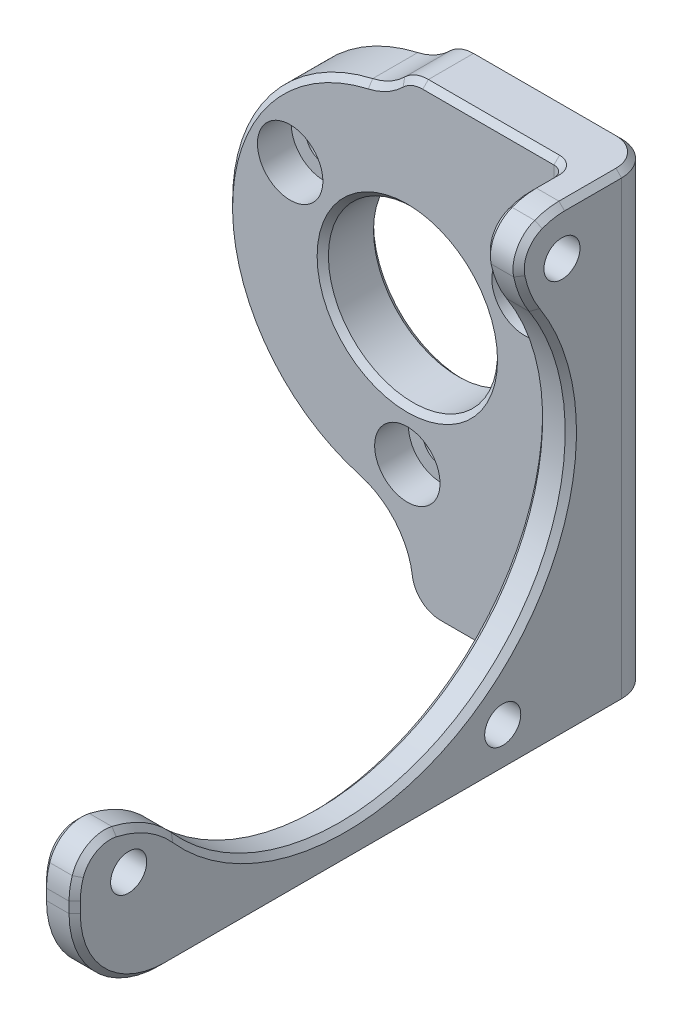
from build123d import *

# Parameters (mm, degrees)
SKETCH_1_R                = 16
EXTRUDE_1_DEPTH           = 5
F_3_0MM_1_D               = 3
F_3_0MM_1_DEPTH           = 3
F_3_0MM_1_TIP             = 0.901290929
HOLE_WIZARD_1_D           = 3.2
HOLE_WIZARD_1_DEPTH       = 5
HOLE_WIZARD_1_CBORE_D     = 5.8
HOLE_WIZARD_1_CBORE_DEPTH = 3
HOLE_WIZARD_1_TIP         = 0.96137699
EXTRUDE_2_DEPTH           = 5
SKETCH_9_W                = 3
SKETCH_9_H                = 46
EXTRUDE_3_DEPTH           = 46.5
SKETCH_12_R               = 1.6
CUT_EXTRUDE_1_DEPTH       = 45
CUT_EXTRUDE_2_DEPTH       = 62.483737687
SKETCH_17_W               = 28.420595315
SKETCH_17_H               = 5
CUT_EXTRUDE_3_DEPTH       = 59.908827861
FILLET_3_R                = 6
FILLET_4_R                = 3
FILLET_5_R                = 1
FILLET_6_R                = 8
CUT_EXTRUDE_4_DEPTH       = 64.326534875
CUT_EXTRUDE_4_DEPTH_BACK  = 64.326534875
SKETCH_18_W               = 60.691939919
SKETCH_18_H               = 58.869698126
SKETCH_19_R               = 7.5
CUT_EXTRUDE_5_DEPTH       = 55.591666189
CHAMFER_1_SIZE            = 0.5


with BuildPart() as part:
    # 草图1 → 凸台-拉伸1 (new body)
    with BuildSketch(Plane.XY):
        Circle(SKETCH_1_R)
    extrude(amount=EXTRUDE_1_DEPTH)

    # Ø3.0mm 暗销孔1
    with Locations(Plane.XY.offset(5)):
        with Locations((0, 12), (10.392304845, -6), (-10.392304845, -6)):
            Hole(F_3_0MM_1_D / 2, depth=F_3_0MM_1_DEPTH)
            with Locations((0, 0, -(F_3_0MM_1_DEPTH + F_3_0MM_1_TIP / 2))):  # 118° drill point
                Cone(0, F_3_0MM_1_D / 2, F_3_0MM_1_TIP, mode=Mode.SUBTRACT)

    # 孔1
    with Locations(Plane(origin=(0, 0, 0), x_dir=(-1, 0, 0), z_dir=(0, 0, -1))):
        with Locations((0, -12), (-10.392304845, 6), (10.392304845, 6)):
            CounterBoreHole(HOLE_WIZARD_1_D / 2, HOLE_WIZARD_1_CBORE_D / 2, HOLE_WIZARD_1_CBORE_DEPTH, depth=HOLE_WIZARD_1_DEPTH)
            with Locations((0, 0, -(HOLE_WIZARD_1_DEPTH + HOLE_WIZARD_1_TIP / 2))):  # 118° drill point
                Cone(0, HOLE_WIZARD_1_D / 2, HOLE_WIZARD_1_TIP, mode=Mode.SUBTRACT)

    # 草图8 → 凸台-拉伸2 (add)
    with BuildSketch(Plane.XY):
        with BuildLine():
            Line((0, 23), (17, 23))
            Line((17, 23), (17, -23))
            Line((17, -23), (0, -23))
            Line((0, -23), (0, -16))
            ThreePointArc((0, -16), (16, 0), (0, 16))
            Line((0, 16), (0, 23))
        make_face()
    extrude(amount=EXTRUDE_2_DEPTH)

    # 草图9 → 凸台-拉伸3 (add)
    with BuildSketch(Plane(origin=(0, 0, 0), x_dir=(-1, 0, 0), z_dir=(0, 0, -1))):
        with Locations((-15.5, 0)):
            Rectangle(SKETCH_9_W, SKETCH_9_H)
    extrude(amount=EXTRUDE_3_DEPTH)

    # 草图12 → 切除-拉伸1 (cut)
    with BuildSketch(Plane(origin=(17, 0, 0), x_dir=(0, 0, -1), z_dir=(1, 0, 0))):
        with Locations(Location((3.285846384, 13.959899742, 0), (0, 0, 90))):
            Circle(SKETCH_12_R)
        with Locations(Location((36.459899742, 19.214153616, 0), (0, 0, 90))):
            Circle(SKETCH_12_R)
        with Locations(Location((41.714153616, -13.959899742, 0), (0, 0, 90))):
            Circle(SKETCH_12_R)
        with Locations(Location((8.540100258, -19.214153616, 0), (0, 0, 90))):
            Circle(SKETCH_12_R)
    extrude(amount=-CUT_EXTRUDE_1_DEPTH, mode=Mode.SUBTRACT)

    # 草图14 → 切除-拉伸2 (cut, through all)
    with BuildSketch(Plane(origin=(17, 0, 0), x_dir=(0, 0, -1), z_dir=(1, 0, 0))):
        with BuildLine():
            Line((7.285846384, 23), (7.285846384, 16.255659243))
            ThreePointArc((7.285846384, 16.255659243), (6.878739032, 13.431405246), (5.690564256, 10.837106162))
            ThreePointArc((5.690564256, 10.837106162), (10.391665009, -15.918172751), (37.430987945, -13.306599828))
            ThreePointArc((37.430987945, -13.306599828), (40.805821772, -10.83485182), (44.896481918, -9.959899742))
            Line((44.896481918, -9.959899742), (46.5, -9.959899742))
            Line((46.5, -9.959899742), (46.5, 23))
            Line((46.5, 23), (7.285846384, 23))
        make_face()
    extrude(amount=-CUT_EXTRUDE_2_DEPTH, mode=Mode.SUBTRACT)

    # 草图17 → 切除-拉伸3 (cut, through all)
    with BuildSketch(Plane.XY.offset(5)):
        with Locations((14.210297658, 20.5)):
            Rectangle(SKETCH_17_W, SKETCH_17_H)
    extrude(amount=-CUT_EXTRUDE_3_DEPTH, mode=Mode.SUBTRACT)

    # 圆角3
    # the kernel refuses this fillet: 6 mm, written as the material it adds along each edge
    with BuildSketch(Plane(origin=(0, -16, 0), x_dir=(-0.9904775075289876, 0.1376746421065417, 0), z_dir=(0, 0, 1))) as fillet_3_piece_1:
        with BuildLine():
            CenterArc((5.2316364, 5.942865045), FILLET_3_R, 187.913310066, 74.173379868)
            Line((-0.711228645, 5.116817193), (-0.830085946, 5.100296235))
            Line((-0.830085946, 5.100296235), (-0.118857301, -0.016520957))
            Line((-0.118857301, -0.016520957), (0.016520957, -0.118857301))
            ThreePointArc((0.016520957, -0.118857301), (2.202794274, 0.03235988), (4.38906759, -0.118857301))
            Line((4.38906759, -0.118857301), (4.405588547, 0))
        make_face()
    extrude(amount=5)
    with BuildSketch(Plane(origin=(0, 16, 0), x_dir=(-0.993666814064824, -0.11236664374387297, 0), z_dir=(0, 0, 1))) as fillet_3_piece_2:
        with BuildLine():
            CenterArc((4.269932462, -5.962000884), FILLET_3_R, 96.45176027, 42.061664666)
            Line((-0.224733287, -1.987333628), (-0.314626602, -1.907840283))
            ThreePointArc((-0.314626602, -1.907840283), (-0.231606661, -0.980182817), (-0.119240018, 0.013483997))
            Line((-0.119240018, 0.013483997), (0.013483997, 0.119240018))
            ThreePointArc((0.013483997, 0.119240018), (1.7978663, 0.018669025), (3.582248603, 0.119240018))
            Line((3.582248603, 0.119240018), (3.5957326, 0))
        make_face()
    extrude(amount=5)
    # the kernel refuses this fillet: 6 mm, written as the material it takes off along each edge
    with BuildSketch(Plane(origin=(27.207517679, -9.959899742, -46.5), x_dir=(0, 0, 1), z_dir=(-1, 0, 0))) as fillet_3_2_piece_1:
        with BuildLine():
            CenterArc((6, -4.083007072), FILLET_3_R, 137.117180669, 42.882819331)
            Line((0, -4.083007072), (-0.12, -4.083007072))
            Line((-0.12, -4.083007072), (-0.12, 0))
            Line((-0.12, 0), (0, 0.12))
            ThreePointArc((0, 0.12), (0.801759041, 0.12), (1.515588444, 0.081660141))
            Line((1.515588444, 0.081660141), (1.603518082, 0))
        make_face()
    extrude(amount=23.415035358, mode=Mode.SUBTRACT)
    with BuildSketch(Plane(origin=(3.426044847, 18, -7.285846384), x_dir=(0, 0, 1), z_dir=(1, 0, 0))) as fillet_3_2_piece_2:
        with BuildLine():
            CenterArc((4.229582061, 6), FILLET_3_R, 225.176083116, 44.823916884)
            Line((0, 1.744340757), (-0.084591641, 1.659227573))
            ThreePointArc((-0.084591641, 1.659227573), (-0.12, 0.872170379), (-0.12, 0))
            Line((-0.12, 0), (0, -0.12))
            Line((0, -0.12), (4.229582061, -0.12))
            Line((4.229582061, -0.12), (4.229582061, 0))
        make_face()
    extrude(amount=24.147910306, mode=Mode.SUBTRACT)

    # 圆角4
    fillet_4_edges = [part.edges().sort_by_distance(p)[0] for p in [
        (17, -2.5, 5),
        (15.5, -9.959899742, -44.896481918),
        (0, -23, 2.5),
        (0, 18, 2.5),
        (15.5, 16.255659243, -7.285846384),
    ]]
    fillet(fillet_4_edges, radius=FILLET_4_R)

    # 圆角5
    fillet_5_edges = [part.edges().sort_by_distance(p)[0] for p in [
        (14, -2.5, 0),
    ]]
    fillet(fillet_5_edges, radius=FILLET_5_R)

    # 圆角6
    fillet_6_edges = [part.edges().sort_by_distance(p)[0] for p in [
        (15.5, -23, -46.5),
    ]]
    fillet(fillet_6_edges, radius=FILLET_6_R)


with BuildPart() as body_2:
    # 镜向1: mirrored copy
    add(part.part.mirror(Plane.XY.offset(5)))

    # 草图19 → 切除-拉伸5 (cut, through all)
    with BuildSketch(Plane.XY.offset(10)):
        Circle(SKETCH_19_R)
    extrude(amount=-CUT_EXTRUDE_5_DEPTH, mode=Mode.SUBTRACT)

    # 倒角1
    chamfer_1_edges = [body_2.edges().sort_by_distance(p)[0] for p in [
        (17, -15.918172751, 20.391665009),
        (17, -11.343083088, 49.821989751),
        (17, 18, 10.528132161),
        (17, -14.521453407, 56.5),
        (17, -13.120063884, 56.42860531),
        (14, 17.899238657, 14.151245267),
        (-15.994794668, 0.408097436, 5),
        (-15.994794668, 0.408097436, 10),
        (-1.458623572, -17.244798923, 5),
        (-2.041852688, 16.175901434, 10),
        (8.462074056, -23, 5),
        (7.962074056, -23, 10),
        (17, -23, 28.25),
        (16.121320344, -23, 5.878679656),
        (7.184813213, 18, 10),
        (-1.458623572, -17.244798923, 10),
        (0.239238095, 17.778888667, 10),
        (0.94500821, -22.254552116, 10),
        (7.684813213, 18, 5),
        (-2.041852688, 16.175901434, 5),
        (0.239238095, 17.778888667, 5),
        (0.94500821, -22.254552116, 5),
        (16.121320344, 18, 5.878679656),
        (17, 12.444073597, 16.530943185),
        (14, 12.444073597, 16.530943185),
        (17, 17.899238657, 14.151245267),
        (17, -10.527865197, 54.849185717),
        (17, 16.230924248, 16.769699588),
        (14, -13.120063884, 56.42860531),
        (14, -10.527865197, 54.849185717),
        (14, 16.230924248, 16.769699588),
        (14, 18, 12.028132161),
        (13.707106781, 18, 10.292893219),
        (13.707106781, -23, 10.292893219),
        (14, -14.521453407, 56.5),
        (14, -23, 29.75),
        (14, -20.656854249, 54.156854249),
        (17, -20.656854249, 54.156854249),
        (-7.5, 0, 5),
        (-7.5, 0, 10),
        (14, -15.918172751, 20.391665009),
        (14, -11.343083088, 49.821989751),
    ]]
    chamfer(chamfer_1_edges, length=CHAMFER_1_SIZE)


with BuildPart() as part_1:
    add(part.part)

    # 草图18 → 切除-拉伸4 (cut, two sides: drawn at the far end of the back side and taken through both)
    with BuildSketch(Plane(origin=(0, 0, 0), x_dir=(1, 0, 0), z_dir=(0, 1, 0)).offset(-CUT_EXTRUDE_4_DEPTH_BACK)):
        with Locations((-2.212398845, 24.434849063)):
            Rectangle(SKETCH_18_W, SKETCH_18_H)
    extrude(amount=CUT_EXTRUDE_4_DEPTH + CUT_EXTRUDE_4_DEPTH_BACK, mode=Mode.SUBTRACT)


solid = body_2.part
